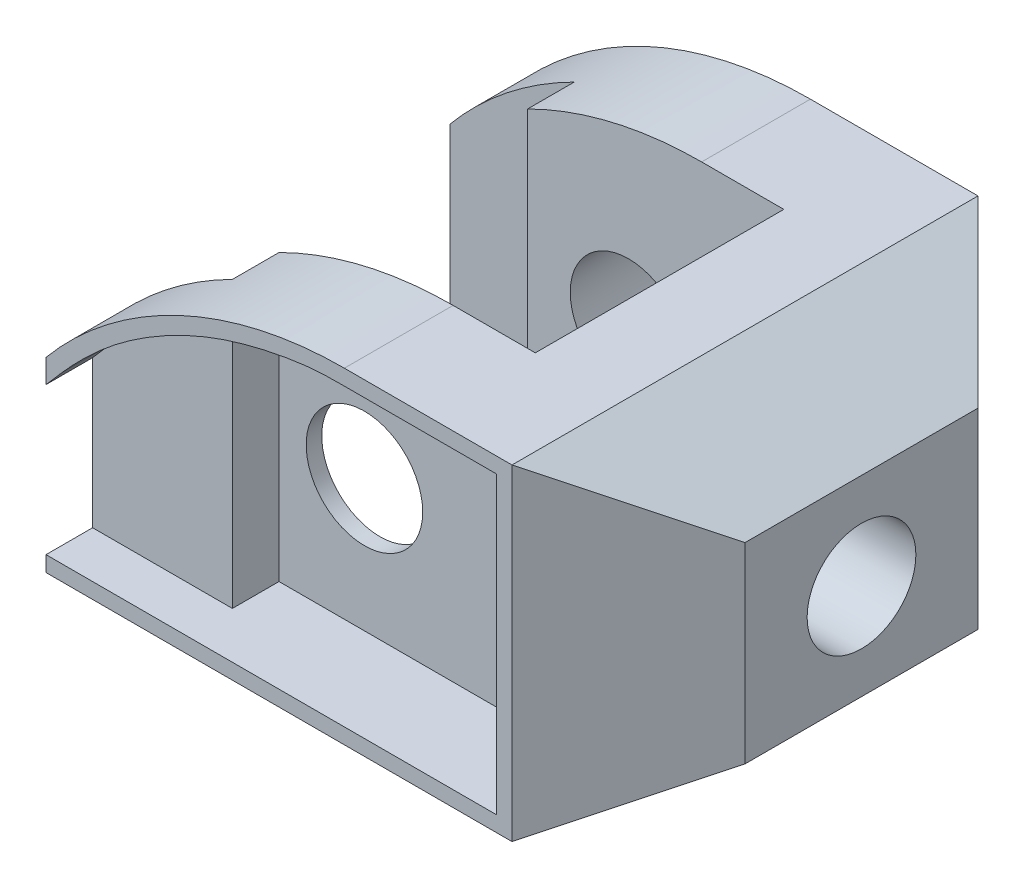
from build123d import *

# Parameters (mm, degrees)
BOSS_EXTRUDE1_DEPTH     = 60
CUT_EXTRUDE1_DEPTH      = 100
CUT_EXTRUDE1_DEPTH_BACK = 100
SKETCH2_R               = 7.5
CUT_EXTRUDE2_DEPTH      = 105.828431258
CUT_EXTRUDE3_DEPTH      = 105.828431258
CUT_EXTRUDE3_DEPTH_BACK = 105.828431258
SKETCH4_W               = 49
SKETCH4_H               = 32
CUT_EXTRUDE4_DEPTH      = 105.828431258
CUT_EXTRUDE4_DEPTH_BACK = 105.828431258
SKETCH5_W               = 16
SKETCH5_H               = 6
CUT_EXTRUDE6_DEPTH      = 100
CUT_EXTRUDE6_DEPTH_BACK = 100
SKETCH6_R               = 7
CUT_EXTRUDE7_DEPTH      = 6
CUT_EXTRUDE13_START     = -6
CUT_EXTRUDE13_OUTLINE_R = 7.5
CUT_EXTRUDE13_DEPTH     = 6


# Read off the part's stored shape, not the designer's step: Cut-Extrude13
with BuildPart() as part:
    # Sketch1 → Boss-Extrude1 (new body)
    with BuildSketch(Plane.XY):
        with BuildLine():
            Line((60, 18), (38.418745425, 18))
            ThreePointArc((38.418745425, 18), (17.205541989, 13.276925691), (0, 0))
            Line((0, 0), (0, -24))
            Line((0, -24), (60, -24))
            Line((60, -24), (75, -15.339745962))
            Line((75, -15.339745962), (75, 9.339745962))
            Line((75, 9.339745962), (60, 18))
        make_face()
    extrude(amount=BOSS_EXTRUDE1_DEPTH)

    # Sketch2 → Cut-Extrude1 (cut, two sides: drawn at the far end of the back side and taken through both)
    with BuildSketch(Plane.XY.offset(60).offset(-CUT_EXTRUDE1_DEPTH_BACK)):
        with Locations((29, -5)):
            Circle(SKETCH2_R)
    extrude(amount=CUT_EXTRUDE1_DEPTH + CUT_EXTRUDE1_DEPTH_BACK, mode=Mode.SUBTRACT)

    # Sketch3 → Cut-Extrude2 (cut, through all)
    with BuildSketch(Plane(origin=(0, 18, 0), x_dir=(1, 0, 0), z_dir=(0, 1, 0))):
        Polygon((60, 0), (75, -15), (75, 0), align=None)
        Polygon((60, -60), (75, -60), (75, -45), align=None)
    extrude(amount=-CUT_EXTRUDE2_DEPTH, mode=Mode.SUBTRACT)

    # Sketch4 → Cut-Extrude3 (cut, two sides: drawn at the far end of the back side and taken through both)
    with BuildSketch(Plane(origin=(0, 18, 0), x_dir=(1, 0, 0), z_dir=(0, 1, 0)).offset(-CUT_EXTRUDE3_DEPTH_BACK)):
        with Locations((24.5, -30)):
            Rectangle(SKETCH4_W, SKETCH4_H)
    extrude(amount=CUT_EXTRUDE3_DEPTH + CUT_EXTRUDE3_DEPTH_BACK, mode=Mode.SUBTRACT)

    # Sketch5 → Cut-Extrude4 (cut, two sides: drawn at the far end of the back side and taken through both)
    with BuildSketch(Plane(origin=(0, 18, 0), x_dir=(1, 0, 0), z_dir=(0, 1, 0)).offset(-CUT_EXTRUDE4_DEPTH_BACK)):
        with Locations((8, -11)):
            Rectangle(SKETCH5_W, SKETCH5_H)
        with Locations((8, -49)):
            Rectangle(SKETCH5_W, SKETCH5_H)
    extrude(amount=CUT_EXTRUDE4_DEPTH + CUT_EXTRUDE4_DEPTH_BACK, mode=Mode.SUBTRACT)

    # Sketch6 → Cut-Extrude6 (cut, two sides: drawn at the far end of the back side and taken through both)
    with BuildSketch(Plane(origin=(75, 0, 0), x_dir=(0, 0, -1), z_dir=(1, 0, 0)).offset(-CUT_EXTRUDE6_DEPTH_BACK)):
        with Locations((-30, -3)):
            Circle(SKETCH6_R)
    extrude(amount=CUT_EXTRUDE6_DEPTH + CUT_EXTRUDE6_DEPTH_BACK, mode=Mode.SUBTRACT)

    # 3DSketch1 → Cut-Extrude7 (cut)
    with BuildSketch(Plane(origin=(2, -22, 60), x_dir=(0.8274757743917585, 0.5615014183372646, 0), z_dir=(0, 0, -1))):
        with BuildLine():
            Line((0, 0), (46.338643366, 31.444079427))
            Line((46.338643366, 31.444079427), (67.675697263, 0))
            Line((67.675697263, 0), (51.472683469, -10.994902217))
            add(Edge.make_bspline(
                [(51.472683469, -10.994902217), (51.00988811, -11.308941925), (50.54709275, -11.622981633), (50.081937087, -11.933401281), (48.672308272, -12.842939856), (47.19895125, -13.654736784), (46.194725989, -14.158808627), (43.645035729, -15.341959521), (41.037130207, -16.372005027), (39.451628921, -16.928242653), (36.239509448, -17.903795074), (32.945954255, -18.578814885), (31.283999686, -18.84258235), (27.940100514, -19.225413824), (24.576949104, -19.324401234), (22.894937643, -19.299992929), (20.094000133, -19.130990082), (17.316239244, -18.739706134), (16.20712535, -18.550994584), (14.685796858, -18.252372423), (13.175745435, -17.907974305), (12.762523967, -17.809287194), (12.350651667, -17.705660499), (11.940378642, -17.596347472)],
                knots=[0, 0, 0, 0, 0, 0, 0.067720945, 0.067720945, 0.067720945, 0.203162835, 0.203162835, 0.203162835, 0.406325669, 0.406325669, 0.406325669, 0.609488504, 0.609488504, 0.609488504, 0.812651339, 0.812651339, 0.812651339, 0.94859619, 0.94859619, 0.94859619, 1, 1, 1, 1, 1, 1], degree=5))
            Line((11.940378642, -17.596347472), (8.989958239, -16.810238314))
            Line((8.989958239, -16.810238314), (-1.654951549, -1.123002837))
            Line((-1.654951549, -1.123002837), (0, 0))
        make_face()
    extrude(amount=CUT_EXTRUDE7_DEPTH, mode=Mode.SUBTRACT)

    # Cut-Extrude13 outline → Cut-Extrude13 (cut)
    with BuildSketch(Plane.XY.offset(54).offset(CUT_EXTRUDE13_START)):
        with BuildLine():
            Line((58, 16), (38.418745425, 16))
            add(Edge.make_bspline(
                [(38.418745425, 16), (37.859459734, 16), (37.300174044, 16), (36.740967929, 15.995679173), (35.063827034, 15.956791732), (33.388834665, 15.801241966), (32.274825535, 15.654475296), (29.500677707, 15.201849301), (26.764327053, 14.589844353), (25.140034933, 14.159856293), (23.537172375, 13.661674471), (21.959650667, 13.089890217)],
                knots=[0, 0, 0, 0, 0, 0, 0.067720945, 0.067720945, 0.067720945, 0.203162835, 0.203162835, 0.203162835, 0.406325669, 0.406325669, 0.406325669, 0.406325669, 0.406325669, 0.406325669], degree=5))
            ThreePointArc((21.959650667, 13.089890217), (19.961391414, 12.309435597), (18, 11.440474621))
            Line((18, 11.440474621), (18, -22))
            Line((18, -22), (58, -22))
            Line((58, -22), (58, 16))
        make_face()
        with Locations((29, -5)):
            Circle(CUT_EXTRUDE13_OUTLINE_R, mode=Mode.SUBTRACT)
    extrude(amount=CUT_EXTRUDE13_DEPTH, mode=Mode.SUBTRACT)


solid = part.part
